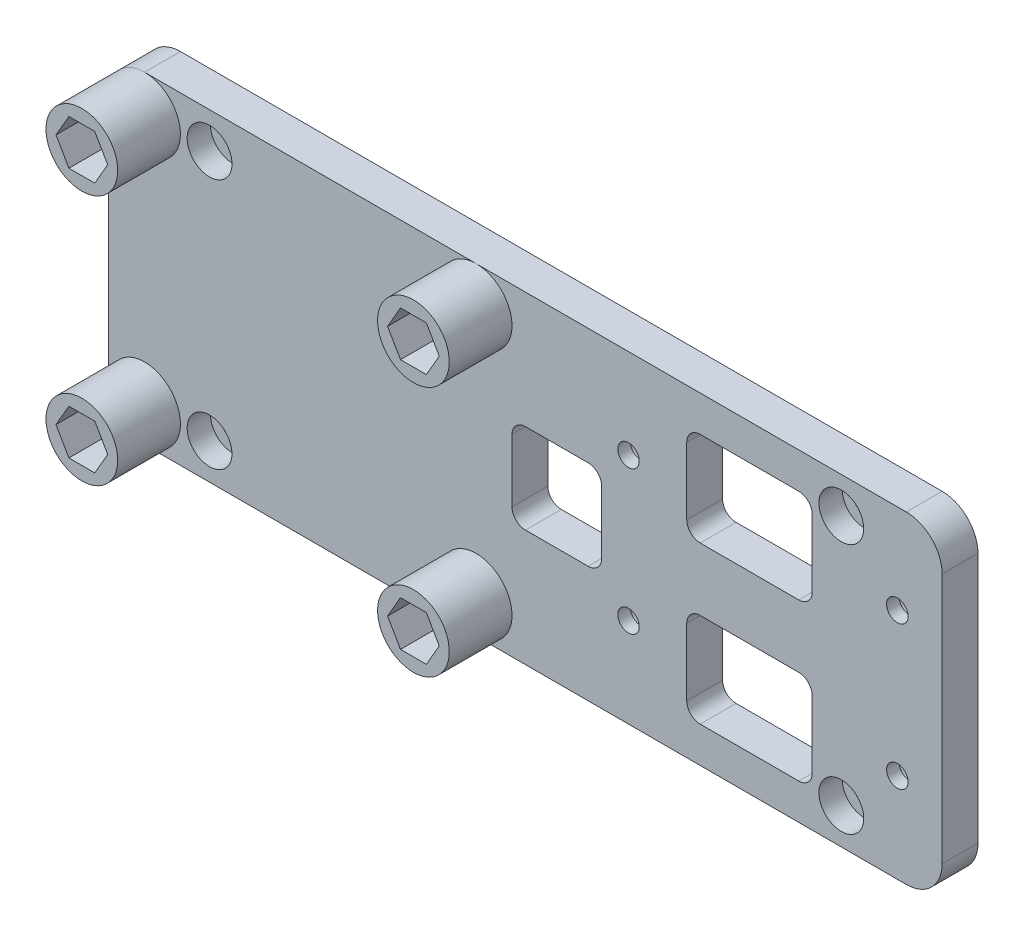
from build123d import *

# Parameters (mm, degrees)
SKETCH1_W                                        = 46
SKETCH1_H                                        = 36
BOSS_EXTRUDE1_DEPTH                              = 4
CBORE_FOR_M2_PAN_HEAD_MACHINE_SCREW1_D           = 2.4
CBORE_FOR_M2_PAN_HEAD_MACHINE_SCREW1_CBORE_D     = 5
CBORE_FOR_M2_PAN_HEAD_MACHINE_SCREW1_CBORE_DEPTH = 2.6
SKETCH6_W                                        = 47
SKETCH6_H                                        = 36
BOSS_EXTRUDE2_DEPTH                              = 4
SKETCH7_R                                        = 4
BOSS_EXTRUDE3_DEPTH                              = 7
CUT_EXTRUDE3_DEPTH                               = 6.5
FILLET3_R                                        = 4
SKETCH13_W                                       = 14
SKETCH13_H                                       = 28
CUT_EXTRUDE5_DEPTH                               = 27
SKETCH16_W                                       = 14
SKETCH16_H                                       = 7
BOSS_EXTRUDE4_DEPTH                              = 4
SKETCH17_W                                       = 10
SKETCH17_H                                       = 10
CUT_EXTRUDE6_DEPTH                               = 10
FILLET4_R                                        = 1.5
CBORE_START                                      = 36.211611197
CBORE_FOR_M2_PAN_HEAD_MACHINE_SCREW2_OUT_R       = 2.5
CBORE_FOR_M2_PAN_HEAD_MACHINE_SCREW2_DEPTH       = 2.6
CBORE_START_2                                    = 34.811611197
CBORE_FOR_M2_PAN_HEAD_MACHINE_SCREW2_2_O_R       = 1.2
CBORE_FOR_M2_PAN_HEAD_MACHINE_SCREW2_2_DEPTH     = 1.4


# Read off the part's stored shape, not the designer's step: CBORE for M2 Pan Head Machine Screw2
with BuildPart() as part:
    # Sketch1 → Boss-Extrude1 (new body)
    with BuildSketch(Plane(origin=(0, 0, 34.811611197), x_dir=(-1, 0, 0), z_dir=(0, 0, -1))):
        Rectangle(SKETCH1_W, SKETCH1_H)
    extrude(amount=-BOSS_EXTRUDE1_DEPTH)

    # CBORE for M2 Pan Head Machine Screw1 (through all)
    with Locations(Plane(origin=(0, 0, 34.811611197), x_dir=(-1, 0, 0), z_dir=(0, 0, -1))):
        with Locations((12, -8), (-18, -8), (-18, 8), (12, 8)):
            CounterBoreHole(CBORE_FOR_M2_PAN_HEAD_MACHINE_SCREW1_D / 2, CBORE_FOR_M2_PAN_HEAD_MACHINE_SCREW1_CBORE_D / 2, CBORE_FOR_M2_PAN_HEAD_MACHINE_SCREW1_CBORE_DEPTH)

    # Sketch6 → Boss-Extrude2 (add)
    with BuildSketch(Plane.XY.offset(38.811611197)):
        with Locations((-46.5, 0)):
            Rectangle(SKETCH6_W, SKETCH6_H)
    extrude(amount=-BOSS_EXTRUDE2_DEPTH)

    # Sketch7 → Boss-Extrude3 (add)
    with BuildSketch(Plane.XY.offset(38.811611197)):
        with Locations(Location((-66, 14, 0), (0, 0, 180))):
            Circle(SKETCH7_R)
        with Locations(Location((-29, 14, 0), (0, 0, 90))):
            Circle(SKETCH7_R)
        with Locations(Location((-66, -14, 0), (0, 0, 180))):
            Circle(SKETCH7_R)
        with Locations(Location((-29, -14, 0), (0, 0, 270))):
            Circle(SKETCH7_R)
    extrude(amount=BOSS_EXTRUDE3_DEPTH)

    # Sketch10 → Cut-Extrude3 (cut)
    with BuildSketch(Plane.XY.offset(45.811611197)):
        Polygon((-64.556624327, 16.5), (-67.443375673, 16.5), (-68.886751346, 14), (-67.443375673, 11.5), (-64.556624327, 11.5), (-63.113248654, 14), align=None)
        Polygon((-64.556624327, -11.5), (-67.443375673, -11.5), (-68.886751346, -14), (-67.443375673, -16.5), (-64.556624327, -16.5), (-63.113248654, -14), align=None)
        Polygon((-27.556624327, 16.5), (-30.443375673, 16.5), (-31.886751346, 14), (-30.443375673, 11.5), (-27.556624327, 11.5), (-26.113248654, 14), align=None)
        Polygon((-27.556624327, -11.5), (-30.443375673, -11.5), (-31.886751346, -14), (-30.443375673, -16.5), (-27.556624327, -16.5), (-26.113248654, -14), align=None)
    extrude(amount=-CUT_EXTRUDE3_DEPTH, mode=Mode.SUBTRACT)

    # Fillet3
    fillet3_edges = [part.edges().sort_by_distance(p)[0] for p in [
        (-70, -18, 36.811611197),
        (23, -18, 36.811611197),
        (23, 18, 36.811611197),
        (-70, 18, 36.811611197),
    ]]
    fillet(fillet3_edges, radius=FILLET3_R)

    # Sketch13 → Cut-Extrude5 (cut)
    with BuildSketch(Plane.XY.offset(38.811611197)):
        with Locations((1.5, 0)):
            Rectangle(SKETCH13_W, SKETCH13_H)
    extrude(amount=-CUT_EXTRUDE5_DEPTH, mode=Mode.SUBTRACT)

    # Sketch16 → Boss-Extrude4 (add)
    with BuildSketch(Plane.XY.offset(38.811611197)):
        with Locations((1.5, 0)):
            Rectangle(SKETCH16_W, SKETCH16_H)
    extrude(amount=-BOSS_EXTRUDE4_DEPTH)

    # Sketch17 → Cut-Extrude6 (cut)
    with BuildSketch(Plane.XY.offset(38.811611197)):
        with Locations((-20, 0)):
            Rectangle(SKETCH17_W, SKETCH17_H)
    extrude(amount=-CUT_EXTRUDE6_DEPTH, mode=Mode.SUBTRACT)

    # Fillet4
    fillet4_edges = [part.edges().sort_by_distance(p)[0] for p in [
        (-5.5, 14, 36.811611197),
        (8.5, 14, 36.811611197),
        (8.5, -14, 36.811611197),
        (-5.5, -14, 36.811611197),
        (8.5, -3.5, 36.811611197),
        (8.5, 3.5, 36.811611197),
        (-5.5, 3.5, 36.811611197),
        (-5.5, -3.5, 36.811611197),
        (-25, -5, 36.811611197),
        (-25, 5, 36.811611197),
        (-15, 5, 36.811611197),
        (-15, -5, 36.811611197),
    ]]
    fillet(fillet4_edges, radius=FILLET4_R)

    # CBORE for M2 Pan Head Machine Screw2 out → CBORE for M2 Pan Head Machine Screw2 (cut)
    with BuildSketch(Plane.XY.offset(CBORE_START)):
        with Locations((-58.75, 14)):
            Circle(CBORE_FOR_M2_PAN_HEAD_MACHINE_SCREW2_OUT_R)
        with Locations((11.75, -14)):
            Circle(CBORE_FOR_M2_PAN_HEAD_MACHINE_SCREW2_OUT_R)
        with Locations((-58.75, -14)):
            Circle(CBORE_FOR_M2_PAN_HEAD_MACHINE_SCREW2_OUT_R)
        with Locations((11.75, 14)):
            Circle(CBORE_FOR_M2_PAN_HEAD_MACHINE_SCREW2_OUT_R)
    extrude(amount=CBORE_FOR_M2_PAN_HEAD_MACHINE_SCREW2_DEPTH, mode=Mode.SUBTRACT)

    # CBORE for M2 Pan Head Machine Screw2 2 o → CBORE for M2 Pan Head Machine Screw2 2 (cut)
    with BuildSketch(Plane.XY.offset(CBORE_START_2)):
        with Locations((-58.75, 14)):
            Circle(CBORE_FOR_M2_PAN_HEAD_MACHINE_SCREW2_2_O_R)
        with Locations((11.75, -14)):
            Circle(CBORE_FOR_M2_PAN_HEAD_MACHINE_SCREW2_2_O_R)
        with Locations((-58.75, -14)):
            Circle(CBORE_FOR_M2_PAN_HEAD_MACHINE_SCREW2_2_O_R)
        with Locations((11.75, 14)):
            Circle(CBORE_FOR_M2_PAN_HEAD_MACHINE_SCREW2_2_O_R)
    extrude(amount=CBORE_FOR_M2_PAN_HEAD_MACHINE_SCREW2_2_DEPTH, mode=Mode.SUBTRACT)


solid = part.part
